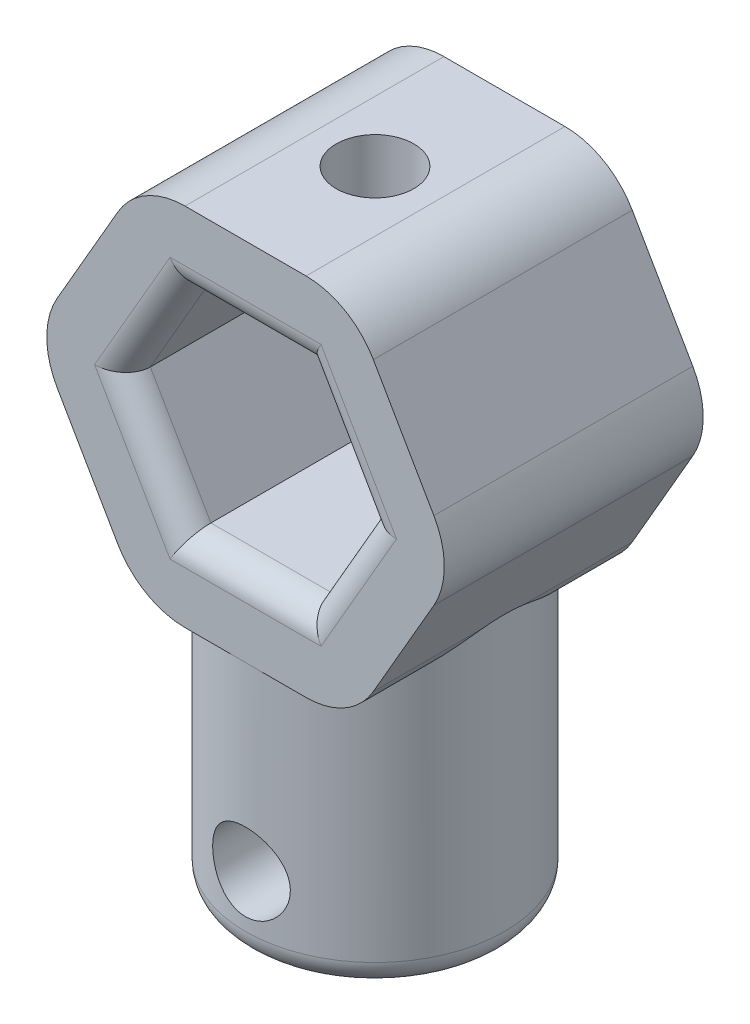
from build123d import *

# Parameters (mm, degrees)
ESBO_O1_R                = 5
ESBO_O1_R_2              = 2.1
RESSALTO_EXTRUS_O1_DEPTH = 12
ESBO_O2_R                = 1.5
CORTE_EXTRUS_O1_DEPTH    = 10
RESSALTO_EXTRUS_O2_DEPTH = 5
ESBO_O4_R                = 1.5
CORTE_EXTRUS_O2_DEPTH    = 5
FILETE1_R                = 1
FILETE2_R                = 3


with BuildPart() as part:
    # Esboço1 → Ressalto-extrusão1 (new body)
    with BuildSketch(Plane(origin=(0, 0, 0), x_dir=(1, 0, 0), z_dir=(0, 1, 0))):
        with Locations(Location((0, 0, 0), (0, 0, 270))):
            Circle(ESBO_O1_R)
        with Locations(Location((0, 0, 0), (0, 0, 270))):
            Circle(ESBO_O1_R_2, mode=Mode.SUBTRACT)
    extrude(amount=RESSALTO_EXTRUS_O1_DEPTH)

    # Esboço2 → Corte-extrusão1 (cut)
    with BuildSketch(Plane.XY):
        with Locations(Location((0, 3, 0), (0, 0, 180))):
            Circle(ESBO_O2_R)
    extrude(amount=CORTE_EXTRUS_O1_DEPTH, mode=Mode.SUBTRACT)

    # Esboço3 → Ressalto-extrusão2 (add, symmetric)
    with BuildSketch(Plane.XY):
        Polygon((4.070319398, 10), (8.140638796, 17.05), (4.070319398, 24.1), (-4.070319398, 24.1), (-8.140638796, 17.05), (-4.070319398, 10), align=None)
        Polygon((2.33826859, 13), (4.67653718, 17.05), (2.33826859, 21.1), (-2.33826859, 21.1), (-4.67653718, 17.05), (-2.33826859, 13), align=None, mode=Mode.SUBTRACT)
    extrude(amount=RESSALTO_EXTRUS_O2_DEPTH, both=True)

    # Esboço4 → Corte-extrusão2 (cut)
    with BuildSketch(Plane(origin=(0, 24.1, 0), x_dir=(1, 0, 0), z_dir=(0, 1, 0))):
        with Locations(Location((0, 0, 0), (0, 0, 270))):
            Circle(ESBO_O4_R)
    extrude(amount=-CORTE_EXTRUS_O2_DEPTH, mode=Mode.SUBTRACT)

    # Filete1
    filete1_edges = [part.edges().sort_by_distance(p)[0] for p in [
        (0, 0, -5),
        (0, 13, -5),
        (3.507402885, 15.025, -5),
        (3.507402885, 19.075, -5),
        (0, 21.1, -5),
        (-3.507402885, 19.075, -5),
        (-3.507402885, 15.025, -5),
        (0, 13, 5),
        (3.507402885, 15.025, 5),
        (3.507402885, 19.075, 5),
        (0, 21.1, 5),
        (-3.507402885, 19.075, 5),
        (-3.507402885, 15.025, 5),
        (0, 0, -2.1),
    ]]
    fillet(filete1_edges, radius=FILETE1_R - 0.0001)  # a hair under: the kernel refuses the full size

    # Filete2
    filete2_edges = [part.edges().sort_by_distance(p)[0] for p in [
        (-4.070319398, 10, -3.95193836),
        (-4.070319398, 10, 3.95193836),
        (8.140638796, 17.05, 0),
        (4.070319398, 10, 3.95193836),
        (4.070319398, 10, -3.95193836),
        (4.070319398, 24.1, 0),
        (-4.070319398, 24.1, 0),
        (-8.140638796, 17.05, 0),
    ]]
    fillet(filete2_edges, radius=FILETE2_R)


solid = part.part
